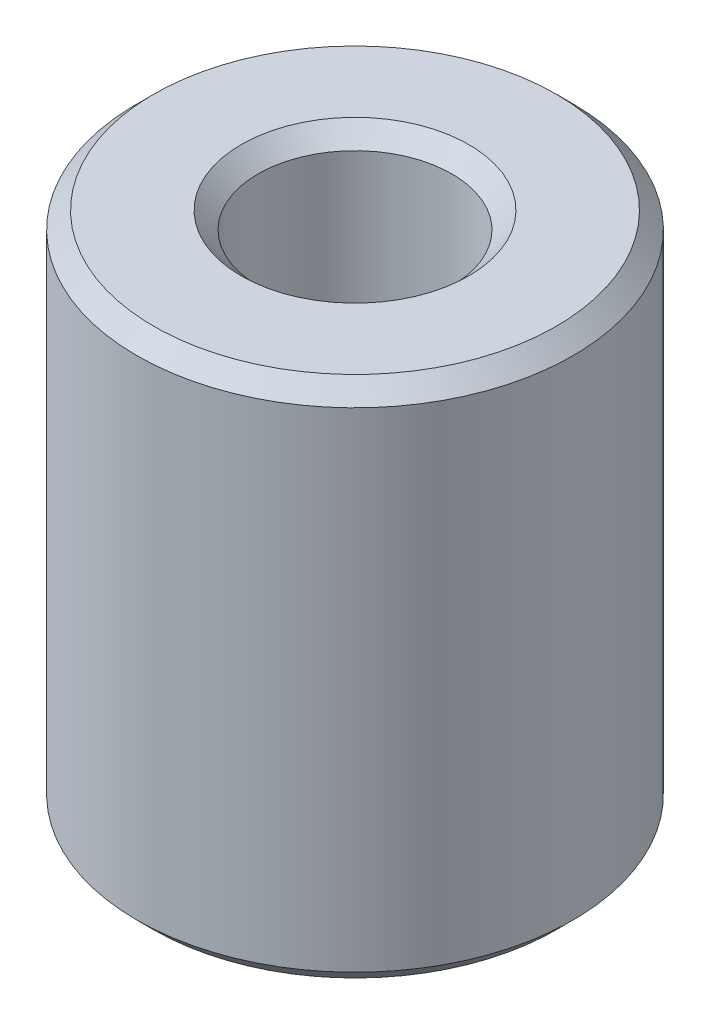
from build123d import *

# Parameters (mm, degrees)
SKETCH1_R           = 10
BOSS_EXTRUDE1_DEPTH = 23.967323461
SKETCH2_R           = 4.442891149
CUT_EXTRUDE1_DEPTH  = 28.828629033
CHAMFER1_SIZE       = 0.775910704


with BuildPart() as part:
    # Sketch1 → Boss-Extrude1 (new body)
    with BuildSketch(Plane(origin=(0, 0, 0), x_dir=(1, 0, 0), z_dir=(0, 1, 0))):
        Circle(SKETCH1_R)
    extrude(amount=BOSS_EXTRUDE1_DEPTH)

    # Sketch2 → Cut-Extrude1 (cut, through all)
    with BuildSketch(Plane(origin=(0, 0, 0), x_dir=(1, 0, 0), z_dir=(0, 1, 0))):
        Circle(SKETCH2_R)
    extrude(amount=CUT_EXTRUDE1_DEPTH, mode=Mode.SUBTRACT)

    # Chamfer1
    chamfer1_edges = [part.edges().sort_by_distance(p)[0] for p in [
        (-4.442891149, 23.967323461, 0),
        (-4.442891149, 0, 0),
        (-10, 0, 0),
        (-10, 23.967323461, 0),
    ]]
    chamfer(chamfer1_edges, length=CHAMFER1_SIZE)


solid = part.part
